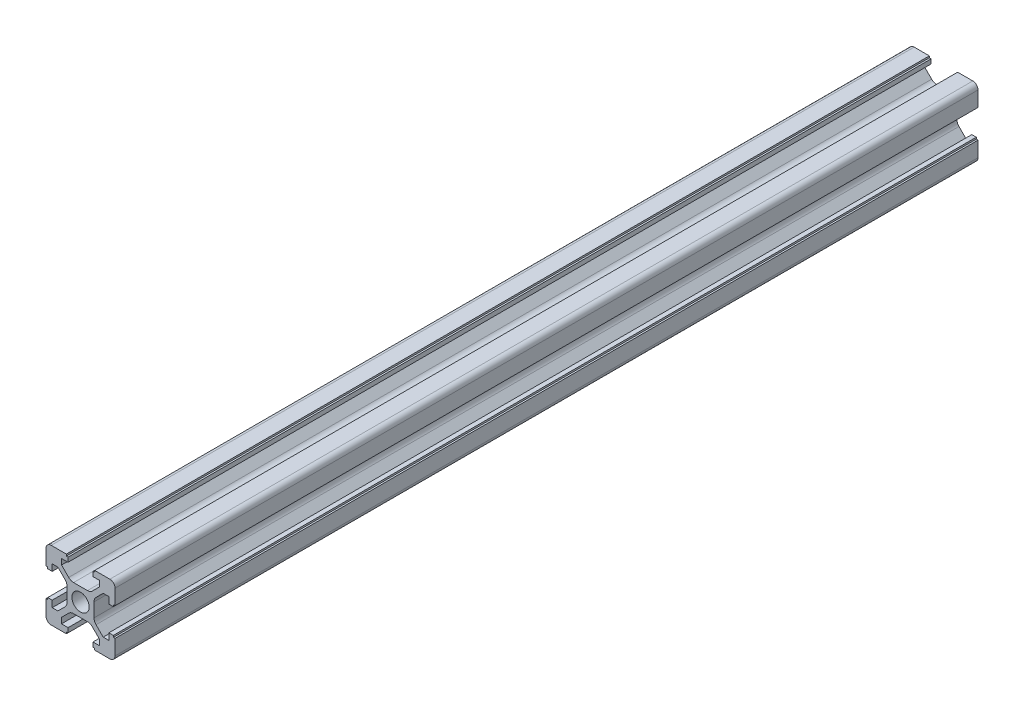
from build123d import *

# Parameters (mm, degrees)
SKETCH1_R           = 2.5
BOSS_EXTRUDE2_DEPTH = 250


with BuildPart() as part:
    # Sketch1 → Boss-Extrude2 (new body)
    with BuildSketch(Plane.XY):
        with BuildLine():
            Line((10, -8.5), (10, -4.1))
            Line((10, -4.1), (9.5, -4.1))
            Line((9.5, -4.1), (9.5, -3.6))
            Line((9.5, -3.6), (8.2, -3.6))
            Line((8.2, -3.6), (8.2, -5.5))
            Line((8.2, -5.5), (6.560660172, -5.5))
            Line((6.560660172, -5.5), (4.485786438, -3.425126266))
            ThreePointArc((4.485786438, -3.425126266), (4.052240935, -2.776279568), (3.9, -2.010912703))
            Line((3.9, -2.010912703), (3.9, 2.010912703))
            ThreePointArc((3.9, 2.010912703), (4.052240935, 2.776279568), (4.485786438, 3.425126266))
            Line((4.485786438, 3.425126266), (6.560660172, 5.5))
            Line((6.560660172, 5.5), (8.2, 5.5))
            Line((8.2, 5.5), (8.2, 3.6))
            Line((8.2, 3.6), (9.5, 3.6))
            Line((9.5, 3.6), (9.5, 4.1))
            Line((9.5, 4.1), (10, 4.1))
            Line((10, 4.1), (10, 8.5))
            ThreePointArc((10, 8.5), (9.560660172, 9.560660172), (8.5, 10))
            Line((8.5, 10), (4.1, 10))
            Line((4.1, 10), (4.1, 9.5))
            Line((4.1, 9.5), (3.6, 9.5))
            Line((3.6, 9.5), (3.6, 8.2))
            Line((3.6, 8.2), (5.5, 8.2))
            Line((5.5, 8.2), (5.5, 6.560660172))
            Line((5.5, 6.560660172), (3.425126266, 4.485786438))
            ThreePointArc((3.425126266, 4.485786438), (2.776279568, 4.052240935), (2.010912703, 3.9))
            Line((2.010912703, 3.9), (-2.010912703, 3.9))
            ThreePointArc((-2.010912703, 3.9), (-2.776279568, 4.052240935), (-3.425126266, 4.485786438))
            Line((-3.425126266, 4.485786438), (-5.5, 6.560660172))
            Line((-5.5, 6.560660172), (-5.5, 8.2))
            Line((-5.5, 8.2), (-3.6, 8.2))
            Line((-3.6, 8.2), (-3.6, 9.5))
            Line((-3.6, 9.5), (-4.1, 9.5))
            Line((-4.1, 9.5), (-4.1, 10))
            Line((-4.1, 10), (-8.5, 10))
            ThreePointArc((-8.5, 10), (-9.560660172, 9.560660172), (-10, 8.5))
            Line((-10, 8.5), (-10, 4.1))
            Line((-10, 4.1), (-9.5, 4.1))
            Line((-9.5, 4.1), (-9.5, 3.6))
            Line((-9.5, 3.6), (-8.2, 3.6))
            Line((-8.2, 3.6), (-8.2, 5.5))
            Line((-8.2, 5.5), (-6.560660172, 5.5))
            Line((-6.560660172, 5.5), (-4.485786438, 3.425126266))
            ThreePointArc((-4.485786438, 3.425126266), (-4.052240935, 2.776279568), (-3.9, 2.010912703))
            Line((-3.9, 2.010912703), (-3.9, -2.010912703))
            ThreePointArc((-3.9, -2.010912703), (-4.052240935, -2.776279568), (-4.485786438, -3.425126266))
            Line((-4.485786438, -3.425126266), (-6.560660172, -5.5))
            Line((-6.560660172, -5.5), (-8.2, -5.5))
            Line((-8.2, -5.5), (-8.2, -3.6))
            Line((-8.2, -3.6), (-9.5, -3.6))
            Line((-9.5, -3.6), (-9.5, -4.1))
            Line((-9.5, -4.1), (-10, -4.1))
            Line((-10, -4.1), (-10, -8.5))
            ThreePointArc((-10, -8.5), (-9.560660172, -9.560660172), (-8.5, -10))
            Line((-8.5, -10), (-4.1, -10))
            Line((-4.1, -10), (-4.1, -9.5))
            Line((-4.1, -9.5), (-3.6, -9.5))
            Line((-3.6, -9.5), (-3.6, -8.2))
            Line((-3.6, -8.2), (-5.5, -8.2))
            Line((-5.5, -8.2), (-5.5, -6.560660172))
            Line((-5.5, -6.560660172), (-3.425126266, -4.485786438))
            ThreePointArc((-3.425126266, -4.485786438), (-2.776279568, -4.052240935), (-2.010912703, -3.9))
            Line((-2.010912703, -3.9), (2.010912703, -3.9))
            ThreePointArc((2.010912703, -3.9), (2.776279568, -4.052240935), (3.425126266, -4.485786438))
            Line((3.425126266, -4.485786438), (5.5, -6.560660172))
            Line((5.5, -6.560660172), (5.5, -8.2))
            Line((5.5, -8.2), (3.6, -8.2))
            Line((3.6, -8.2), (3.6, -9.5))
            Line((3.6, -9.5), (4.1, -9.5))
            Line((4.1, -9.5), (4.1, -10))
            Line((4.1, -10), (8.5, -10))
            ThreePointArc((8.5, -10), (9.560660172, -9.560660172), (10, -8.5))
        make_face()
        Circle(SKETCH1_R, mode=Mode.SUBTRACT)
    extrude(amount=BOSS_EXTRUDE2_DEPTH)


solid = part.part
